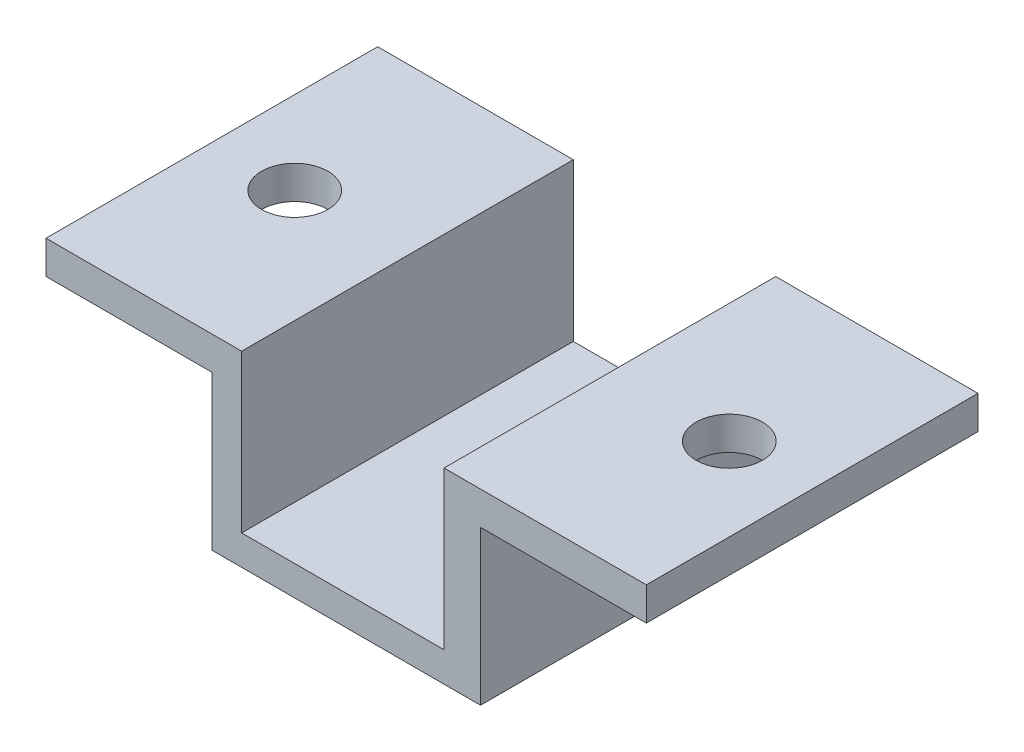
from build123d import *

# Parameters (mm, degrees)
SKETCH2_W           = 45.979999988
SKETCH2_H           = 25.4
BOSS_EXTRUDE1_DEPTH = 14.340000022
SKETCH3_W           = 15.499999988
SKETCH3_H           = 25.4
CUT_EXTRUDE1_DEPTH  = 12.0540018
SKETCH4_W           = 12.7
SKETCH4_H           = 25.4
CUT_EXTRUDE2_DEPTH  = 11.800000022
SKETCH5_W           = 12.7
SKETCH5_H           = 25.4
CUT_EXTRUDE3_DEPTH  = 11.800000022
SKETCH6_R           = 2.54
CUT_EXTRUDE4_DEPTH  = 2.54
SKETCH7_R           = 2.54
CUT_EXTRUDE5_DEPTH  = 2.54


with BuildPart() as part:
    # Sketch2 → Boss-Extrude1 (new body)
    with BuildSketch(Plane(origin=(0, 0, 0), x_dir=(1, 0, 0), z_dir=(0, 1, 0))):
        with Locations((22.989999994, 12.7)):
            Rectangle(SKETCH2_W, SKETCH2_H)
    extrude(amount=BOSS_EXTRUDE1_DEPTH)

    # Sketch3 → Cut-Extrude1 (cut)
    with BuildSketch(Plane(origin=(0, 14.340000022, 0), x_dir=(1, 0, 0), z_dir=(0, 1, 0))):
        with Locations((22.735999994, 12.7)):
            Rectangle(SKETCH3_W, SKETCH3_H)
    extrude(amount=-CUT_EXTRUDE1_DEPTH, mode=Mode.SUBTRACT)

    # Sketch4 → Cut-Extrude2 (cut)
    with BuildSketch(Plane(origin=(0, 0, 0), x_dir=(-1, 0, 0), z_dir=(0, -1, 0))):
        with Locations((-6.35, 12.7)):
            Rectangle(SKETCH4_W, SKETCH4_H)
    extrude(amount=-CUT_EXTRUDE2_DEPTH, mode=Mode.SUBTRACT)

    # Sketch5 → Cut-Extrude3 (cut)
    with BuildSketch(Plane(origin=(0, 0, 0), x_dir=(-1, 0, 0), z_dir=(0, -1, 0))):
        with Locations((-39.629999988, 12.7)):
            Rectangle(SKETCH5_W, SKETCH5_H)
    extrude(amount=-CUT_EXTRUDE3_DEPTH, mode=Mode.SUBTRACT)

    # Sketch6 → Cut-Extrude4 (cut)
    with BuildSketch(Plane(origin=(0, 11.800000022, 0), x_dir=(-1, 0, 0), z_dir=(0, -1, 0))):
        with Locations((-6.35, 12.7)):
            Circle(SKETCH6_R)
    extrude(amount=-CUT_EXTRUDE4_DEPTH, mode=Mode.SUBTRACT)

    # Sketch7 → Cut-Extrude5 (cut)
    with BuildSketch(Plane(origin=(0, 11.800000022, 0), x_dir=(-1, 0, 0), z_dir=(0, -1, 0))):
        with Locations((-39.629999988, 12.7)):
            Circle(SKETCH7_R)
    extrude(amount=-CUT_EXTRUDE5_DEPTH, mode=Mode.SUBTRACT)


solid = part.part
